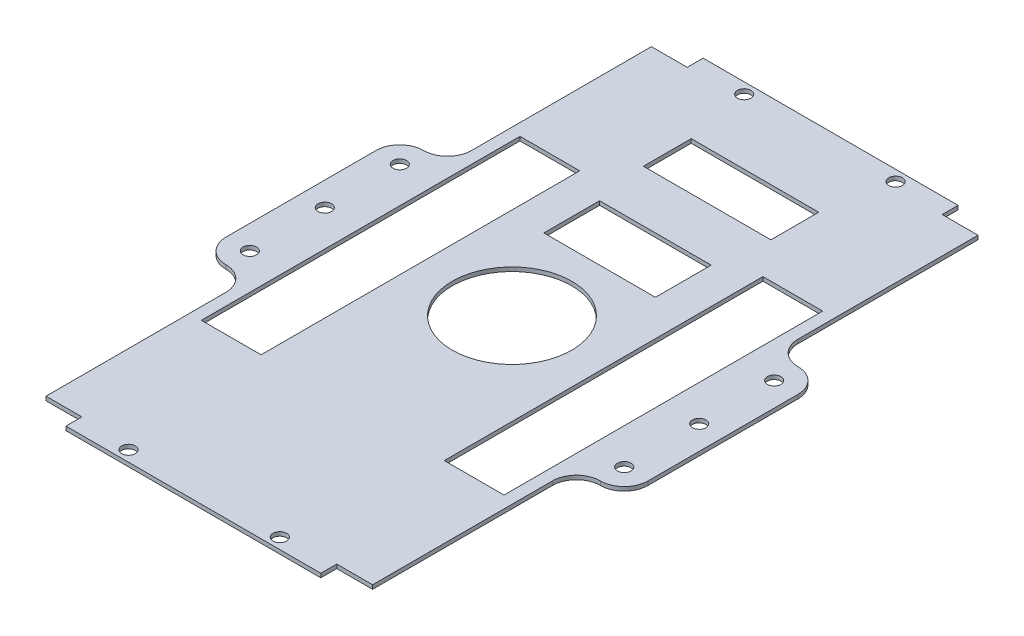
from build123d import *

# Parameters (mm, degrees)
SKETCH_1_R      = 1.7
SKETCH_1_R_2    = 15
SKETCH_1_W      = 32
SKETCH_1_H      = 12
EXTRUDE_1_DEPTH = 1


with BuildPart() as part:
    # 草图1 → 凸台-拉伸1 (new body)
    with BuildSketch(Plane(origin=(0, 0, 0), x_dir=(1, 0, 0), z_dir=(0, 1, 0))):
        with BuildLine():
            ThreePointArc((-47, 24.826061575), (-51.242640687, 23.068702262), (-53, 18.826061575))
            Line((-53, 18.826061575), (-53, -18.826061575))
            ThreePointArc((-53, -18.826061575), (-51.242640687, -23.068702262), (-47, -24.826061575))
            ThreePointArc((-47, -24.826061575), (-42.757359313, -26.583420888), (-41, -30.826061575))
            Line((-41, -30.826061575), (-41, -76))
            Line((-41, -76), (-32, -76))
            Line((-32, -76), (-32, -80))
            Line((-32, -80), (32, -80))
            Line((32, -80), (32, -76))
            Line((32, -76), (41, -76))
            Line((41, -76), (41, -30.826061575))
            ThreePointArc((41, -30.826061575), (42.757359313, -26.583420888), (47, -24.826061575))
            ThreePointArc((47, -24.826061575), (51.242640687, -23.068702262), (53, -18.826061575))
            Line((53, -18.826061575), (53, 18.826061575))
            ThreePointArc((53, 18.826061575), (51.242640687, 23.068702262), (47, 24.826061575))
            ThreePointArc((47, 24.826061575), (42.757359313, 26.583420888), (41, 30.826061575))
            Line((41, 30.826061575), (41, 76))
            Line((41, 76), (32, 76))
            Line((32, 76), (32, 80))
            Line((32, 80), (-32, 80))
            Line((-32, 80), (-32, 76))
            Line((-32, 76), (-41, 76))
            Line((-41, 76), (-41, 30.826061575))
            ThreePointArc((-41, 30.826061575), (-42.757359313, 26.583420888), (-47, 24.826061575))
        make_face()
        with Locations((-19, -77.3)):
            Circle(SKETCH_1_R, mode=Mode.SUBTRACT)
        with Locations((-47, -18.826061575)):
            Circle(SKETCH_1_R, mode=Mode.SUBTRACT)
        with Locations((19, -77.3)):
            Circle(SKETCH_1_R, mode=Mode.SUBTRACT)
        with Locations((47, -18.826061575)):
            Circle(SKETCH_1_R, mode=Mode.SUBTRACT)
        with Locations((-47, 0)):
            Circle(SKETCH_1_R, mode=Mode.SUBTRACT)
        with Locations((-47, 18.826061575)):
            Circle(SKETCH_1_R, mode=Mode.SUBTRACT)
        Polygon((-38, -40), (-38, 40), (-23, 40), (-23, 13), (-23, -13), (-23, -40), align=None, mode=Mode.SUBTRACT)
        Circle(SKETCH_1_R_2, mode=Mode.SUBTRACT)
        Polygon((14, 22), (0, 22), (-14, 22), (-14, 36), (14, 36), align=None, mode=Mode.SUBTRACT)
        with Locations((0, 55)):
            Rectangle(SKETCH_1_W, SKETCH_1_H, mode=Mode.SUBTRACT)
        with Locations((-19, 77.3)):
            Circle(SKETCH_1_R, mode=Mode.SUBTRACT)
        Polygon((38, 40), (38, -40), (23, -40), (23, -13), (23, 13), (23, 40), align=None, mode=Mode.SUBTRACT)
        with Locations((47, 0)):
            Circle(SKETCH_1_R, mode=Mode.SUBTRACT)
        with Locations((47, 18.826061575)):
            Circle(SKETCH_1_R, mode=Mode.SUBTRACT)
        with Locations((19, 77.3)):
            Circle(SKETCH_1_R, mode=Mode.SUBTRACT)
    extrude(amount=EXTRUDE_1_DEPTH)


solid = part.part
